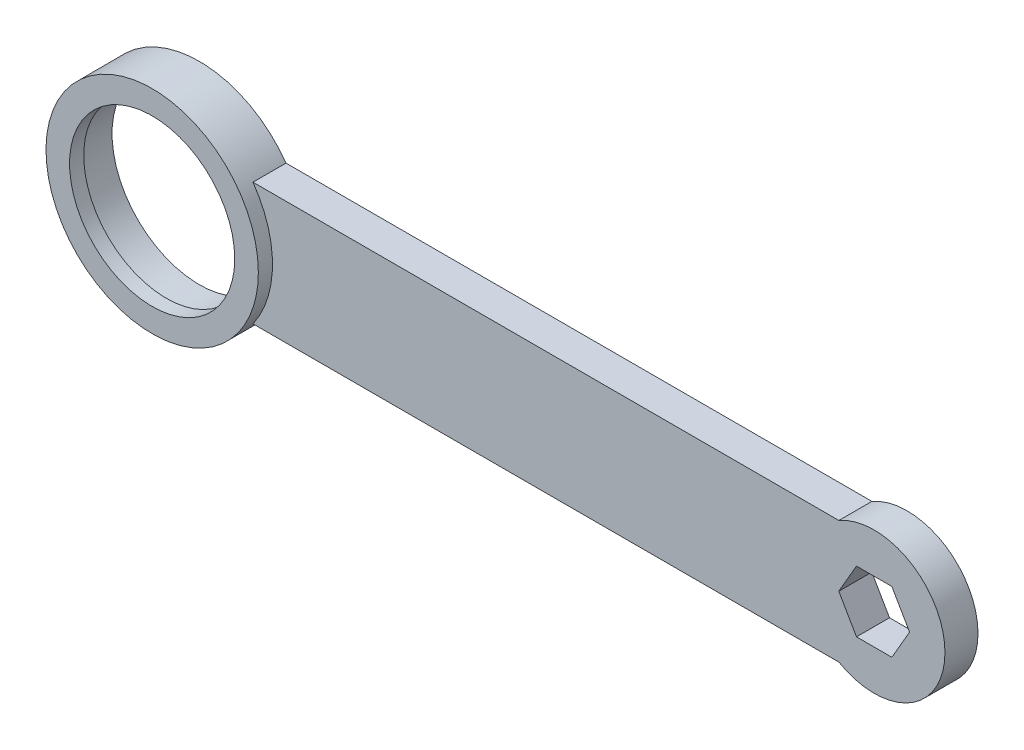
from build123d import *

# Parameters (mm, degrees)
BOSS_EXTRUDE1_DEPTH = 7
SKETCH2_R           = 22.5
BOSS_EXTRUDE2_DEPTH = 3
CUT_EXTRUDE1_DEPTH  = 101.307028667
SKETCH4_R           = 17.5
CUT_EXTRUDE2_DEPTH  = 101.560926806
SKETCH5_R           = 18.5
CUT_EXTRUDE3_DEPTH  = 7


with BuildPart() as part:
    # Sketch1 → Boss-Extrude1 (new body)
    with BuildSketch(Plane.XY):
        with BuildLine():
            Line((-56.635632328, 13), (67.516685226, 13))
            ThreePointArc((67.516685226, 13), (90, 0), (67.516685226, -13))
            Line((67.516685226, -13), (-56.635632328, -13))
            ThreePointArc((-56.635632328, -13), (-97.5, 0), (-56.635632328, 13))
        make_face()
    extrude(amount=BOSS_EXTRUDE1_DEPTH)

    # Sketch2 → Boss-Extrude2 (add)
    with BuildSketch(Plane.XY.offset(7)):
        with Locations((-75, 0)):
            Circle(SKETCH2_R)
    extrude(amount=BOSS_EXTRUDE2_DEPTH)

    # Sketch3 → Cut-Extrude1 (cut, through all)
    with BuildSketch(Plane.XY.offset(7)):
        Polygon((82.5, 0), (78.75, 6.495190528), (71.25, 6.495190528), (67.5, 0), (71.25, -6.495190528), (78.75, -6.495190528), align=None)
    extrude(amount=-CUT_EXTRUDE1_DEPTH, mode=Mode.SUBTRACT)

    # Sketch4 → Cut-Extrude2 (cut, through all)
    with BuildSketch(Plane.XY.offset(10)):
        with Locations((-75, 0)):
            Circle(SKETCH4_R)
    extrude(amount=-CUT_EXTRUDE2_DEPTH, mode=Mode.SUBTRACT)

    # Sketch5 → Cut-Extrude3 (cut)
    with BuildSketch(Plane.XY):
        with Locations((-75, 0)):
            Circle(SKETCH5_R)
    extrude(amount=CUT_EXTRUDE3_DEPTH, mode=Mode.SUBTRACT)


solid = part.part
